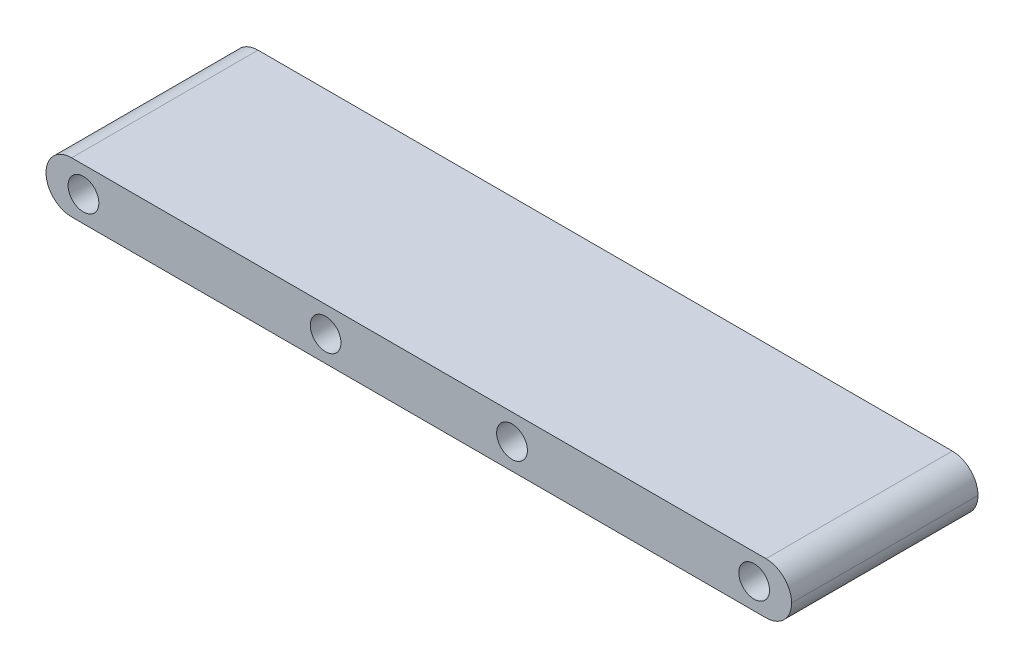
from build123d import *

# Parameters (mm, degrees)
SKETCH_1_W          = 800
SKETCH_1_H          = 55
SKETCH_1_R          = 16.5
EXTRUDE_1_DEPTH     = 200
SKETCH_2_R          = 16.5
CUT_EXTRUDE_1_DEPTH = 827.453265466
FILLET_1_R          = 27.5


with BuildPart() as part:
    # 草图1 → 凸台-拉伸1 (new body)
    with BuildSketch(Plane.XY):
        with Locations((400, 27.5)):
            Rectangle(SKETCH_1_W, SKETCH_1_H)
        with Locations((300, 27.5)):
            Circle(SKETCH_1_R, mode=Mode.SUBTRACT)
        with Locations((500, 27.5)):
            Circle(SKETCH_1_R, mode=Mode.SUBTRACT)
    extrude(amount=EXTRUDE_1_DEPTH)

    # 草图2 → 切除-拉伸1 (cut, through all)
    with BuildSketch(Plane.XY.offset(200)):
        with Locations((759.807621135, 27.5)):
            Circle(SKETCH_2_R)
        with Locations((40.192378865, 27.5)):
            Circle(SKETCH_2_R)
    extrude(amount=-CUT_EXTRUDE_1_DEPTH, mode=Mode.SUBTRACT)

    # 圆角1
    fillet_1_edges = [part.edges().sort_by_distance(p)[0] for p in [
        (0, 0, 100),
        (0, 55, 100),
        (800, 0, 100),
        (800, 55, 100),
    ]]
    fillet(fillet_1_edges, radius=FILLET_1_R - 0.0001)  # a hair under: the kernel refuses the full size


solid = part.part
